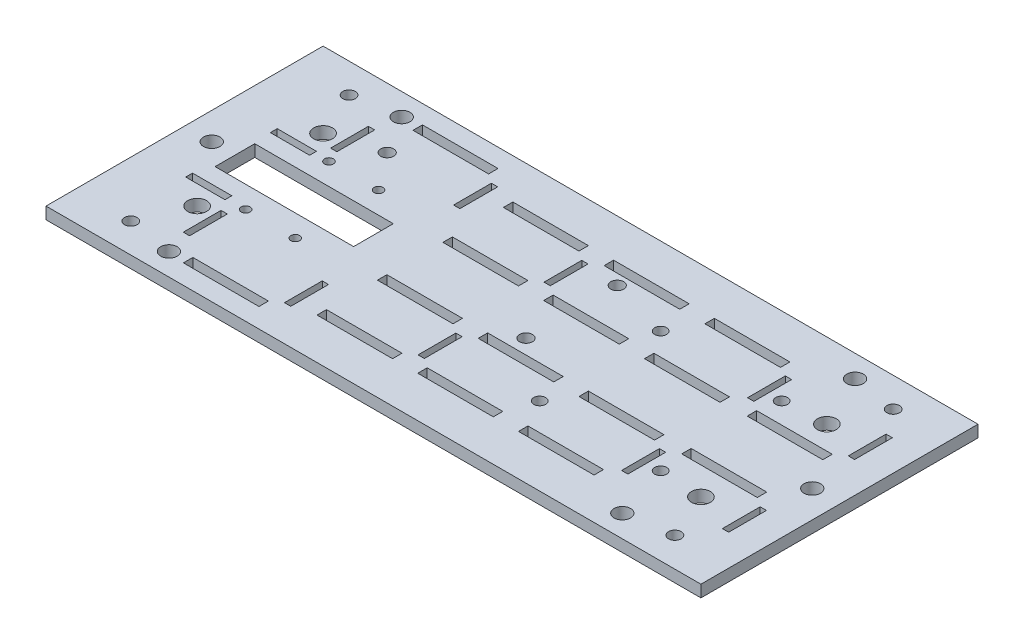
from build123d import *

# Parameters (mm, degrees)
SKETCH1_W           = 165.1
SKETCH1_H           = 69.85
BOSS_EXTRUDE1_DEPTH = 3
CUT_EXTRUDE1_REACH  = 91.684
SKETCH6_W           = 34.925
SKETCH6_H           = 10
SKETCH6_R           = 1.5
SKETCH6_R_2         = 1.625
CUT_EXTRUDE3_REACH  = 91.684
SKETCH8_R           = 2.38125
SKETCH9_R           = 2.0828
CUT_EXTRUDE5_DEPTH  = 5.08
SKETCH10_R          = 2.0828
CUT_EXTRUDE6_DEPTH  = 5.08
SKETCH11_R          = 1.125
SKETCH11_R_2        = 1.125000036
CUT_EXTRUDE7_DEPTH  = 41.91
SKETCH12_W          = 19.05
SKETCH12_H          = 2.38125
SKETCH12_W_2        = 9.894876086
SKETCH12_H_2        = 1.732802182
SKETCH12_W_3        = 1.5875
SKETCH12_H_3        = 9.525
SKETCH12_H_4        = 1.732802181
CUT_EXTRUDE8_DEPTH  = 21.336
SKETCH13_R          = 1.5875
CUT_EXTRUDE10_DEPTH = 28.034


with BuildPart() as part:
    # Sketch1 → Boss-Extrude1 (new body)
    with BuildSketch(Plane(origin=(0, 0, 0), x_dir=(1, 0, 0), z_dir=(0, 1, 0))):
        Rectangle(SKETCH1_W, SKETCH1_H)
    extrude(amount=BOSS_EXTRUDE1_DEPTH)

    # Sketch6 → Cut-Extrude1 (cut, up to next)
    with BuildSketch(Plane.XZ, mode=Mode.PRIVATE) as cut_extrude1_sk1:
        with Locations((-52.3875, 0)):
            Rectangle(SKETCH6_W, SKETCH6_H)
    cut_extrude1_tool1 = extrude(cut_extrude1_sk1.sketch, amount=-CUT_EXTRUDE1_REACH, mode=Mode.PRIVATE) & part.part
    # Sketch6 → Cut-Extrude1 (cut, up to next)
    with BuildSketch(Plane.XZ, mode=Mode.PRIVATE) as cut_extrude1_sk2:
        with Locations((22.225, 15.25)):
            Circle(SKETCH6_R)
    cut_extrude1_tool2 = extrude(cut_extrude1_sk2.sketch, amount=-CUT_EXTRUDE1_REACH, mode=Mode.PRIVATE) & part.part
    # Sketch6 → Cut-Extrude1 (cut, up to next)
    with BuildSketch(Plane.XZ, mode=Mode.PRIVATE) as cut_extrude1_sk3:
        with Locations((52.725, 15.25)):
            Circle(SKETCH6_R)
    cut_extrude1_tool3 = extrude(cut_extrude1_sk3.sketch, amount=-CUT_EXTRUDE1_REACH, mode=Mode.PRIVATE) & part.part
    # Sketch6 → Cut-Extrude1 (cut, up to next)
    with BuildSketch(Plane.XZ, mode=Mode.PRIVATE) as cut_extrude1_sk4:
        with Locations((22.225, -15.25)):
            Circle(SKETCH6_R)
    cut_extrude1_tool4 = extrude(cut_extrude1_sk4.sketch, amount=-CUT_EXTRUDE1_REACH, mode=Mode.PRIVATE) & part.part
    # Sketch6 → Cut-Extrude1 (cut, up to next)
    with BuildSketch(Plane.XZ, mode=Mode.PRIVATE) as cut_extrude1_sk5:
        with Locations((52.725, -15.25)):
            Circle(SKETCH6_R)
    cut_extrude1_tool5 = extrude(cut_extrude1_sk5.sketch, amount=-CUT_EXTRUDE1_REACH, mode=Mode.PRIVATE) & part.part
    # Sketch6 → Cut-Extrude1 (cut, up to next)
    with BuildSketch(Plane.XZ, mode=Mode.PRIVATE) as cut_extrude1_sk6:
        with Locations((6.775000039, 3.246015987)):
            Circle(SKETCH6_R_2)
    cut_extrude1_tool6 = extrude(cut_extrude1_sk6.sketch, amount=-CUT_EXTRUDE1_REACH, mode=Mode.PRIVATE) & part.part
    # Sketch6 → Cut-Extrude1 (cut, up to next)
    with BuildSketch(Plane.XZ, mode=Mode.PRIVATE) as cut_extrude1_sk7:
        with Locations((6.775000039, -19.756015987)):
            Circle(SKETCH6_R_2)
    cut_extrude1_tool7 = extrude(cut_extrude1_sk7.sketch, amount=-CUT_EXTRUDE1_REACH, mode=Mode.PRIVATE) & part.part
    # Sketch6 → Cut-Extrude1 (cut, up to next)
    with BuildSketch(Plane.XZ, mode=Mode.PRIVATE) as cut_extrude1_sk8:
        with Locations((-51.225000039, -19.756015987)):
            Circle(SKETCH6_R_2)
    cut_extrude1_tool8 = extrude(cut_extrude1_sk8.sketch, amount=-CUT_EXTRUDE1_REACH, mode=Mode.PRIVATE) & part.part
    add(cut_extrude1_tool1.solids().sort_by_distance((-52.3875, 0, 0))[0], mode=Mode.SUBTRACT)
    add(cut_extrude1_tool2.solids().sort_by_distance((22.225, 0, 15.25))[0], mode=Mode.SUBTRACT)
    add(cut_extrude1_tool3.solids().sort_by_distance((52.725, 0, 15.25))[0], mode=Mode.SUBTRACT)
    add(cut_extrude1_tool4.solids().sort_by_distance((22.225, 0, -15.25))[0], mode=Mode.SUBTRACT)
    add(cut_extrude1_tool5.solids().sort_by_distance((52.725, 0, -15.25))[0], mode=Mode.SUBTRACT)
    add(cut_extrude1_tool6.solids().sort_by_distance((6.775, 0, 3.246016))[0], mode=Mode.SUBTRACT)
    add(cut_extrude1_tool7.solids().sort_by_distance((6.775, 0, -19.756016))[0], mode=Mode.SUBTRACT)
    add(cut_extrude1_tool8.solids().sort_by_distance((-51.225, 0, -19.756016))[0], mode=Mode.SUBTRACT)

    # Sketch8 → Cut-Extrude3 (cut, up to next)
    with BuildSketch(Plane(origin=(0, 3, 0), x_dir=(1, 0, 0), z_dir=(0, 1, 0)), mode=Mode.PRIVATE) as cut_extrude3_sk1:
        with Locations((-63.5, -15.875)):
            Circle(SKETCH8_R)
    cut_extrude3_tool1 = extrude(cut_extrude3_sk1.sketch, amount=-CUT_EXTRUDE3_REACH, mode=Mode.PRIVATE) & part.part
    # Sketch8 → Cut-Extrude3 (cut, up to next)
    with BuildSketch(Plane(origin=(0, 3, 0), x_dir=(1, 0, 0), z_dir=(0, 1, 0)), mode=Mode.PRIVATE) as cut_extrude3_sk2:
        with Locations((-63.5, 15.875)):
            Circle(SKETCH8_R)
    cut_extrude3_tool2 = extrude(cut_extrude3_sk2.sketch, amount=-CUT_EXTRUDE3_REACH, mode=Mode.PRIVATE) & part.part
    # Sketch8 → Cut-Extrude3 (cut, up to next)
    with BuildSketch(Plane(origin=(0, 3, 0), x_dir=(1, 0, 0), z_dir=(0, 1, 0)), mode=Mode.PRIVATE) as cut_extrude3_sk3:
        with Locations((63.5, 15.875)):
            Circle(SKETCH8_R)
    cut_extrude3_tool3 = extrude(cut_extrude3_sk3.sketch, amount=-CUT_EXTRUDE3_REACH, mode=Mode.PRIVATE) & part.part
    # Sketch8 → Cut-Extrude3 (cut, up to next)
    with BuildSketch(Plane(origin=(0, 3, 0), x_dir=(1, 0, 0), z_dir=(0, 1, 0)), mode=Mode.PRIVATE) as cut_extrude3_sk4:
        with Locations((63.5, -15.875)):
            Circle(SKETCH8_R)
    cut_extrude3_tool4 = extrude(cut_extrude3_sk4.sketch, amount=-CUT_EXTRUDE3_REACH, mode=Mode.PRIVATE) & part.part
    add(cut_extrude3_tool1.solids().sort_by_distance((-63.5, 3, 15.875))[0], mode=Mode.SUBTRACT)
    add(cut_extrude3_tool2.solids().sort_by_distance((-63.5, 3, -15.875))[0], mode=Mode.SUBTRACT)
    add(cut_extrude3_tool3.solids().sort_by_distance((63.5, 3, -15.875))[0], mode=Mode.SUBTRACT)
    add(cut_extrude3_tool4.solids().sort_by_distance((63.5, 3, 15.875))[0], mode=Mode.SUBTRACT)

    # Sketch9 → Cut-Extrude5 (cut)
    with BuildSketch(Plane(origin=(0, 3, 0), x_dir=(1, 0, 0), z_dir=(0, 1, 0))):
        with Locations((-75.692, 0)):
            Circle(SKETCH9_R)
        with Locations((75.692, 0)):
            Circle(SKETCH9_R)
    extrude(amount=-CUT_EXTRUDE5_DEPTH, mode=Mode.SUBTRACT)

    # Sketch10 → Cut-Extrude6 (cut)
    with BuildSketch(Plane(origin=(0, 3, 0), x_dir=(1, 0, 0), z_dir=(0, 1, 0))):
        with Locations((57.15, -29.337)):
            Circle(SKETCH10_R)
        with Locations((57.15, 29.337)):
            Circle(SKETCH10_R)
        with Locations((-57.15, -29.337)):
            Circle(SKETCH10_R)
        with Locations((-57.15, 29.337)):
            Circle(SKETCH10_R)
    extrude(amount=-CUT_EXTRUDE6_DEPTH, mode=Mode.SUBTRACT)

    # Sketch11 → Cut-Extrude7 (cut)
    with BuildSketch(Plane(origin=(0, 3, 0), x_dir=(1, 0, 0), z_dir=(0, 1, 0))):
        with Locations((-56.6375, 10.5)):
            Circle(SKETCH11_R)
        with Locations((-44.1375, 10.5)):
            Circle(SKETCH11_R_2)
        with Locations((-44.1375, -10.5)):
            Circle(SKETCH11_R_2)
        with Locations((-56.6375, -10.5)):
            Circle(SKETCH11_R_2)
    extrude(amount=-CUT_EXTRUDE7_DEPTH, mode=Mode.SUBTRACT)

    # Sketch12 → Cut-Extrude8 (cut)
    with BuildSketch(Plane.XZ):
        with Locations((-15.071340952, 23.373504413)):
            Rectangle(SKETCH12_W, SKETCH12_H)
        with Locations((10.328659048, 23.373504413)):
            Rectangle(SKETCH12_W, SKETCH12_H)
        with Locations((35.728659048, 23.373504413)):
            Rectangle(SKETCH12_W, SKETCH12_H)
        with Locations((10.328659048, 8.133504413)):
            Rectangle(SKETCH12_W, SKETCH12_H)
        with Locations((35.728659048, 8.133504413)):
            Rectangle(SKETCH12_W, SKETCH12_H)
        with Locations((-15.071340952, 8.133504413)):
            Rectangle(SKETCH12_W, SKETCH12_H)
        with Locations((-66.323978982, 10.119491273)):
            Rectangle(SKETCH12_W_2, SKETCH12_H_2)
        with Locations((-15.071340952, -8.376495587)):
            Rectangle(SKETCH12_W, SKETCH12_H)
        with Locations((35.728659048, -8.376495587)):
            Rectangle(SKETCH12_W, SKETCH12_H)
        with Locations((10.328659048, -8.376495587)):
            Rectangle(SKETCH12_W, SKETCH12_H)
        with Locations((35.728659048, -23.616495587)):
            Rectangle(SKETCH12_W, SKETCH12_H)
        with Locations((10.328659048, -23.616495587)):
            Rectangle(SKETCH12_W, SKETCH12_H)
        with Locations((-15.071340952, -23.616495587)):
            Rectangle(SKETCH12_W, SKETCH12_H)
        with Locations((-2.371340952, 15.753504413)):
            Rectangle(SKETCH12_W_3, SKETCH12_H_3)
        with Locations((-2.371340952, -15.996495587)):
            Rectangle(SKETCH12_W_3, SKETCH12_H_3)
        with Locations((61.214571176, 7.709998323)):
            Rectangle(SKETCH12_W, SKETCH12_H)
        with Locations((-65.364631792, -10.256675963)):
            Rectangle(SKETCH12_W_2, SKETCH12_H_4)
        with Locations((61.214571176, -8.800001677)):
            Rectangle(SKETCH12_W, SKETCH12_H)
        with Locations((73.914571176, 15.329998323)):
            Rectangle(SKETCH12_W_3, SKETCH12_H_3)
        with Locations((48.514571176, 15.329998323)):
            Rectangle(SKETCH12_W_3, SKETCH12_H_3)
        with Locations((48.514571176, -16.420001677)):
            Rectangle(SKETCH12_W_3, SKETCH12_H_3)
        with Locations((73.914571176, -16.420001677)):
            Rectangle(SKETCH12_W_3, SKETCH12_H_3)
        with Locations((-43.304102612, -29.062103326)):
            Rectangle(SKETCH12_W, SKETCH12_H)
        with Locations((-58.532793167, -18.363697432)):
            Rectangle(SKETCH12_W_3, SKETCH12_H_3)
        with Locations((-30.604102612, -21.442103326)):
            Rectangle(SKETCH12_W_3, SKETCH12_H_3)
        with Locations((-30.604102612, 21.199112152)):
            Rectangle(SKETCH12_W_3, SKETCH12_H_3)
        with Locations((-58.752679303, 18.560478529)):
            Rectangle(SKETCH12_W_3, SKETCH12_H_3)
        with Locations((-43.304102612, 28.819112152)):
            Rectangle(SKETCH12_W, SKETCH12_H)
    extrude(amount=-CUT_EXTRUDE8_DEPTH, mode=Mode.SUBTRACT)

    # Sketch13 → Cut-Extrude10 (cut)
    with BuildSketch(Plane.XZ):
        with Locations((-68.580370043, 27.514580758)):
            Circle(SKETCH13_R)
        with Locations((-68.580370043, -27.514580758)):
            Circle(SKETCH13_R)
        with Locations((68.580370043, -27.514580758)):
            Circle(SKETCH13_R)
        with Locations((68.580370043, 27.514580758)):
            Circle(SKETCH13_R)
    extrude(amount=-CUT_EXTRUDE10_DEPTH, mode=Mode.SUBTRACT)


solid = part.part
